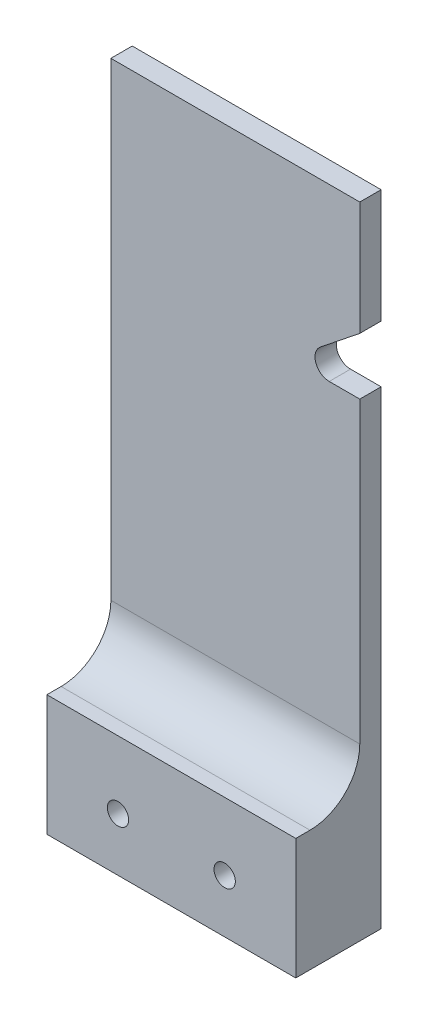
from build123d import *

# Parameters (mm, degrees)
SKETCH_1_W          = 35
SKETCH_1_H          = 90
EXTRUDE_1_DEPTH     = 3
SKETCH_2_W          = 35
SKETCH_2_H          = 17
EXTRUDE_2_DEPTH     = 9
FILLET_1_R          = 7
SKETCH_3_R          = 1.5
CUT_EXTRUDE_3_DEPTH = 50.751884386
CUT_EXTRUDE_4_DEPTH = 50.751884386
FILLET_2_R          = 2


with BuildPart() as part:
    # 草图1 → 凸台-拉伸1 (new body)
    with BuildSketch(Plane.XY):
        Rectangle(SKETCH_1_W, SKETCH_1_H)
    extrude(amount=EXTRUDE_1_DEPTH)

    # 草图2 → 凸台-拉伸2 (add)
    with BuildSketch(Plane.XY.offset(3)):
        with Locations((0, -36.5)):
            Rectangle(SKETCH_2_W, SKETCH_2_H)
    extrude(amount=EXTRUDE_2_DEPTH)

    # 圆角1
    fillet_1_edges = [part.edges().sort_by_distance(p)[0] for p in [
        (0, -28, 3),
    ]]
    fillet(fillet_1_edges, radius=FILLET_1_R)

    # 草图3 → 切除-拉伸3 (cut, through all)
    with BuildSketch(Plane.XY.offset(12)):
        with Locations((-7.5, -37.5)):
            Circle(SKETCH_3_R)
        with Locations((7.5, -37.5)):
            Circle(SKETCH_3_R)
    extrude(amount=-CUT_EXTRUDE_3_DEPTH, mode=Mode.SUBTRACT)

    # 草图4 → 切除-拉伸4 (cut, through all)
    with BuildSketch(Plane(origin=(0, 0, 0), x_dir=(-1, 0, 0), z_dir=(0, 0, -1))):
        Polygon((-17.5, 29), (-17.5, 21), (-7.5, 21), align=None)
    extrude(amount=-CUT_EXTRUDE_4_DEPTH, mode=Mode.SUBTRACT)

    # 圆角2
    fillet_2_edges = [part.edges().sort_by_distance(p)[0] for p in [
        (7.5, 21, 1.5),
    ]]
    fillet(fillet_2_edges, radius=FILLET_2_R)


solid = part.part
